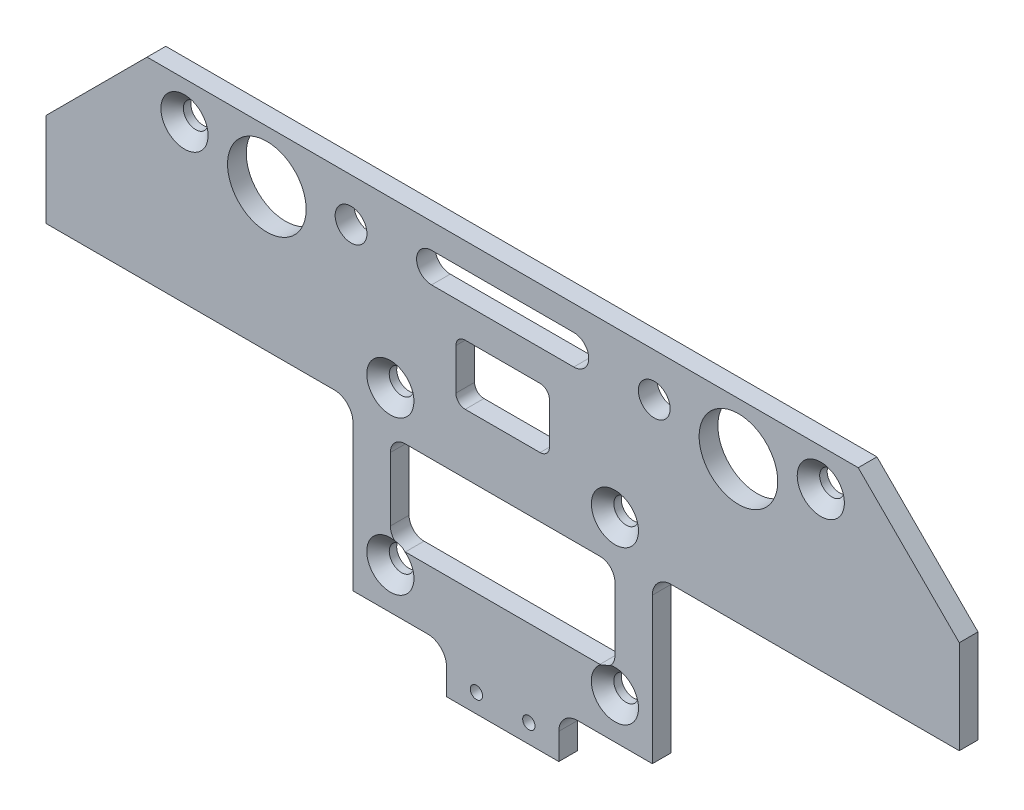
from build123d import *

# Parameters (mm, degrees)
ESQUISSE1_W             = 25
ESQUISSE1_H             = 16
ESQUISSE1_W_2           = 60
ESQUISSE1_H_2           = 25
BOSS_EXTRU_1_DEPTH      = 5
CONG_1_R                = 2.5
CONG_2_R                = 4
CONG_3_R                = 5
D_GAGEMENT_M61_D        = 6.6
D_GAGEMENT_M201_D       = 21
ENL_V_MAT_EXTRU_1_REACH = 220.607
ESQUISSE11_R            = 4.25
BOSS_EXTRU_2_DEPTH      = 5
D_GAGEMENT_M62_D        = 6.6
D_GAGEMENT_M62_DEPTH    = 5
D_GAGEMENT_M62_TIP      = 1.982840043
CONG_4_R                = 5
TROU_TARAUD_M4X0_71_D   = 3.3
CHANFREIN1_SIZE         = 3


with BuildPart() as part:
    # Esquisse1 → Boss.-Extru.1 (new body)
    with BuildSketch(Plane.XY):
        Polygon((0, 0), (0, -52), (55, -52), (55, -96), (80, -96), (80, -108), (110, -108), (110, -96), (135, -96), (135, -52), (190, -52), (190, 0), align=None)
        with Locations((95, -31)):
            Rectangle(ESQUISSE1_W, ESQUISSE1_H, mode=Mode.SUBTRACT)
        with Locations((95, -67.5)):
            Rectangle(ESQUISSE1_W_2, ESQUISSE1_H_2, mode=Mode.SUBTRACT)
        with BuildLine():
            Line((76, -6.71), (114, -6.71))
            ThreePointArc((114, -6.71), (118, -10.71), (114, -14.71))
            Line((114, -14.71), (76, -14.71))
            ThreePointArc((76, -14.71), (72, -10.71), (76, -6.71))
        make_face(mode=Mode.SUBTRACT)
    extrude(amount=BOSS_EXTRU_1_DEPTH)

    # Congé1
    cong_1_edges = [part.edges().sort_by_distance(p)[0] for p in [
        (82.5, -23, 2.5),
        (82.5, -39, 2.5),
        (107.5, -39, 2.5),
        (107.5, -23, 2.5),
    ]]
    fillet(cong_1_edges, radius=CONG_1_R)

    # Congé2
    cong_2_edges = [part.edges().sort_by_distance(p)[0] for p in [
        (65, -55, 2.5),
        (65, -80, 2.5),
        (125, -80, 2.5),
        (125, -55, 2.5),
    ]]
    fillet(cong_2_edges, radius=CONG_2_R)

    # Congé3
    cong_3_edges = [part.edges().sort_by_distance(p)[0] for p in [
        (135, -52, 2.5),
        (55, -52, 2.5),
    ]]
    fillet(cong_3_edges, radius=CONG_3_R)

    # Dégagement M61 (through all)
    with Locations(Plane.XY.offset(5)):
        with Locations((10, -10), (180, -10)):
            Hole(D_GAGEMENT_M61_D / 2)

    # Dégagement M201 (through all)
    with Locations(Plane.XY.offset(5)):
        with Locations((32, -14), (158, -14)):
            Hole(D_GAGEMENT_M201_D / 2)

    # Esquisse11 → Enlèv. mat.-Extru.1 (cut, up to next)
    with BuildSketch(Plane.XY.offset(5), mode=Mode.PRIVATE) as enl_v_mat_extru_1_sk1:
        with Locations((54.5, -11.5)):
            Circle(ESQUISSE11_R)
    enl_v_mat_extru_1_tool1 = extrude(enl_v_mat_extru_1_sk1.sketch, amount=-ENL_V_MAT_EXTRU_1_REACH, mode=Mode.PRIVATE) & part.part
    # Esquisse11 → Enlèv. mat.-Extru.1 (cut, up to next)
    with BuildSketch(Plane.XY.offset(5), mode=Mode.PRIVATE) as enl_v_mat_extru_1_sk2:
        with Locations((135.5, -11.5)):
            Circle(ESQUISSE11_R)
    enl_v_mat_extru_1_tool2 = extrude(enl_v_mat_extru_1_sk2.sketch, amount=-ENL_V_MAT_EXTRU_1_REACH, mode=Mode.PRIVATE) & part.part
    add(enl_v_mat_extru_1_tool1.solids().sort_by_distance((54.5, -11.5, 5))[0], mode=Mode.SUBTRACT)
    add(enl_v_mat_extru_1_tool2.solids().sort_by_distance((135.5, -11.5, 5))[0], mode=Mode.SUBTRACT)

    # Esquisse13 → Boss.-Extru.2 (add)
    with BuildSketch(Plane.XY.offset(5)):
        Polygon((0, 0), (-27, -27), (-27, -52), (0, -52), align=None)
        Polygon((217, -52), (190, -52), (190, 0), (217, -27), align=None)
    extrude(amount=-BOSS_EXTRU_2_DEPTH)

    # Dégagement M62
    with Locations(Plane.XY.offset(5)):
        with Locations((65, -44), (125, -44), (125, -85), (65, -85)):
            Hole(D_GAGEMENT_M62_D / 2, depth=D_GAGEMENT_M62_DEPTH)
            with Locations((0, 0, -(D_GAGEMENT_M62_DEPTH + D_GAGEMENT_M62_TIP / 2))):  # 118° drill point
                Cone(0, D_GAGEMENT_M62_D / 2, D_GAGEMENT_M62_TIP, mode=Mode.SUBTRACT)

    # Congé4
    cong_4_edges = [part.edges().sort_by_distance(p)[0] for p in [
        (110, -96, 2.5),
        (80, -96, 2.5),
    ]]
    fillet(cong_4_edges, radius=CONG_4_R)

    # Trou taraudé M4x0.71 (through all)
    with Locations(Plane.XY.offset(5)):
        with Locations((88, -103), (102, -103)):
            Hole(TROU_TARAUD_M4X0_71_D / 2)

    # Chanfrein1
    # the kernel refuses this chamfer: 3 mm, written as the material it takes off along each edge
    with BuildSketch(Plane(origin=(180, -10, 5), x_dir=(-1, 0, 0), z_dir=(0, -1, 0))) as chanfrein1_piece_1:
        Polygon((3.3, CHANFREIN1_SIZE), (3.3 + CHANFREIN1_SIZE, 0), (3.3, 0), align=None)
    revolve(axis=Axis((180, -10, 5), (0, 0, -1)), mode=Mode.SUBTRACT)
    with BuildSketch(Plane(origin=(10, -10, 5), x_dir=(-1, 0, 0), z_dir=(0, -1, 0))) as chanfrein1_piece_2:
        Polygon((3.3, CHANFREIN1_SIZE), (3.3 + CHANFREIN1_SIZE, 0), (3.3, 0), align=None)
    revolve(axis=Axis((10, -10, 5), (0, 0, -1)), mode=Mode.SUBTRACT)
    with BuildSketch(Plane(origin=(65, -85, 5), x_dir=(-1, 0, 0), z_dir=(0, -1, 0))) as chanfrein1_piece_3:
        Polygon((3.3, CHANFREIN1_SIZE), (3.3 + CHANFREIN1_SIZE, 0), (3.3, 0), align=None)
    revolve(axis=Axis((65, -85, 5), (0, 0, -1)), mode=Mode.SUBTRACT)
    with BuildSketch(Plane(origin=(125, -85, 5), x_dir=(-1, 0, 0), z_dir=(0, -1, 0))) as chanfrein1_piece_4:
        Polygon((3.3, CHANFREIN1_SIZE), (3.3 + CHANFREIN1_SIZE, 0), (3.3, 0), align=None)
    revolve(axis=Axis((125, -85, 5), (0, 0, -1)), mode=Mode.SUBTRACT)
    with BuildSketch(Plane(origin=(125, -44, 5), x_dir=(-1, 0, 0), z_dir=(0, -1, 0))) as chanfrein1_piece_5:
        Polygon((3.3, CHANFREIN1_SIZE), (3.3 + CHANFREIN1_SIZE, 0), (3.3, 0), align=None)
    revolve(axis=Axis((125, -44, 5), (0, 0, -1)), mode=Mode.SUBTRACT)
    with BuildSketch(Plane(origin=(65, -44, 5), x_dir=(-1, 0, 0), z_dir=(0, -1, 0))) as chanfrein1_piece_6:
        Polygon((3.3, CHANFREIN1_SIZE), (3.3 + CHANFREIN1_SIZE, 0), (3.3, 0), align=None)
    revolve(axis=Axis((65, -44, 5), (0, 0, -1)), mode=Mode.SUBTRACT)


solid = part.part
